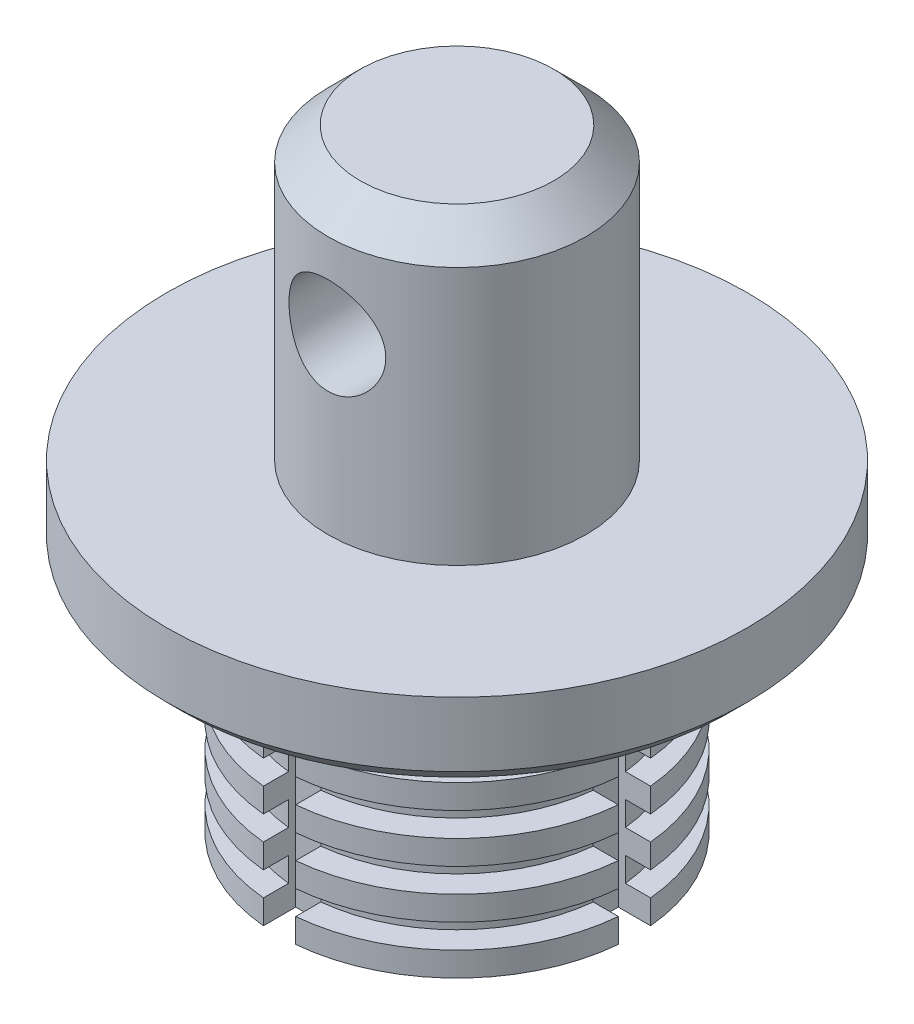
from build123d import *

# Parameters (mm, degrees)
CUT_EXTRUDE1_DEPTH      = 46.738386504
CUT_EXTRUDE1_DEPTH_BACK = 46.738386504
SKETCH2_R               = 3
CHAMFER1_SIZE           = 1
SKETCH3_W               = 1.55
SKETCH3_H               = 1.5
CUT_EXTRUDE3_START      = -1
SKETCH4_R               = 14.7
SKETCH4_R_2             = 11.05
CUT_EXTRUDE3_DEPTH      = 1
SKETCH5_W               = 2
SKETCH5_H               = 3
SKETCH5_W_2             = 3
SKETCH5_H_2             = 2
CUT_EXTRUDE4_DEPTH      = 15
FILLET1_R               = 1
CHAMFER2_SIZE           = 2


with BuildPart() as part:
    # Sketch1 → Revolve1 (revolve)
    with BuildSketch(Plane.XY, mode=Mode.PRIVATE) as revolve1_sk:
        Polygon((0, 0), (11.05, 0), (11.05, 15), (18, 15), (18, 20), (8, 20), (8, 38), (0, 38), align=None)
    revolve(revolve1_sk.sketch.rotate(Axis((0, 0, 0), (0, 1, 0)), 90), axis=Axis((0, 0, 0), (0, 1, 0)))

    # Sketch2 → Cut-Extrude1 (cut, two sides: drawn at the far end of the back side and taken through both)
    with BuildSketch(Plane.XY.offset(-CUT_EXTRUDE1_DEPTH_BACK)):
        with Locations((0, 30.7)):
            Circle(SKETCH2_R)
    extrude(amount=CUT_EXTRUDE1_DEPTH + CUT_EXTRUDE1_DEPTH_BACK, mode=Mode.SUBTRACT)

    # Chamfer1
    chamfer1_edges = [part.edges().sort_by_distance(p)[0] for p in [
        (0, 15, 18),
    ]]
    chamfer(chamfer1_edges, length=CHAMFER1_SIZE)

    # Sketch3 → Cut-Revolve1 (revolve, cut)
    with BuildSketch(Plane.XY, mode=Mode.PRIVATE) as cut_revolve1_sk:
        with Locations((10.275, 2.25)):
            Rectangle(SKETCH3_W, SKETCH3_H)
        with Locations((10.275, 5.25)):
            Rectangle(SKETCH3_W, SKETCH3_H)
        with Locations((10.275, 8.25)):
            Rectangle(SKETCH3_W, SKETCH3_H)
        with Locations((10.275, 11.25)):
            Rectangle(SKETCH3_W, SKETCH3_H)
        with Locations((10.275, 14.25)):
            Rectangle(SKETCH3_W, SKETCH3_H)
    revolve(cut_revolve1_sk.sketch.rotate(Axis((0, -2, 0), (0, 1, 0)), 90), axis=Axis((0, -2, 0), (0, 1, 0)), mode=Mode.SUBTRACT)

    # Sketch4 → Cut-Extrude3 (cut)
    with BuildSketch(Plane.XZ.offset(-15).offset(CUT_EXTRUDE3_START)):
        with Locations(Location((0, 0, 0), (0, 0, 270))):
            Circle(SKETCH4_R)
        with Locations(Location((0, 0, 0), (0, 0, 270))):
            Circle(SKETCH4_R_2, mode=Mode.SUBTRACT)
    extrude(amount=CUT_EXTRUDE3_DEPTH, mode=Mode.SUBTRACT)

    # Sketch5 → Cut-Extrude4 (cut)
    with BuildSketch(Plane.XZ):
        with Locations((0, -10.5)):
            Rectangle(SKETCH5_W, SKETCH5_H)
        with Locations((0, 10.5)):
            Rectangle(SKETCH5_W, SKETCH5_H)
        with Locations((-10.5, 0)):
            Rectangle(SKETCH5_W_2, SKETCH5_H_2)
        with Locations((10.5, 0)):
            Rectangle(SKETCH5_W_2, SKETCH5_H_2)
    extrude(amount=-CUT_EXTRUDE4_DEPTH, mode=Mode.SUBTRACT)

    # Fillet1
    fillet1_edges = [part.edges().sort_by_distance(p)[0] for p in [
        (9.223610907, 15, -1),
        (9.223610907, 15, 1),
        (-1, 15, -9.223610907),
        (1, 15, -9.223610907),
        (-9.223610907, 15, 1),
        (-9.223610907, 15, -1),
        (1, 15, 9.223610907),
        (-1, 15, 9.223610907),
    ]]
    fillet(fillet1_edges, radius=FILLET1_R - 0.0001)  # a hair under: the kernel refuses the full size

    # Chamfer2
    chamfer2_edges = [part.edges().sort_by_distance(p)[0] for p in [
        (0, 38, 8),
    ]]
    chamfer(chamfer2_edges, length=CHAMFER2_SIZE)


solid = part.part
